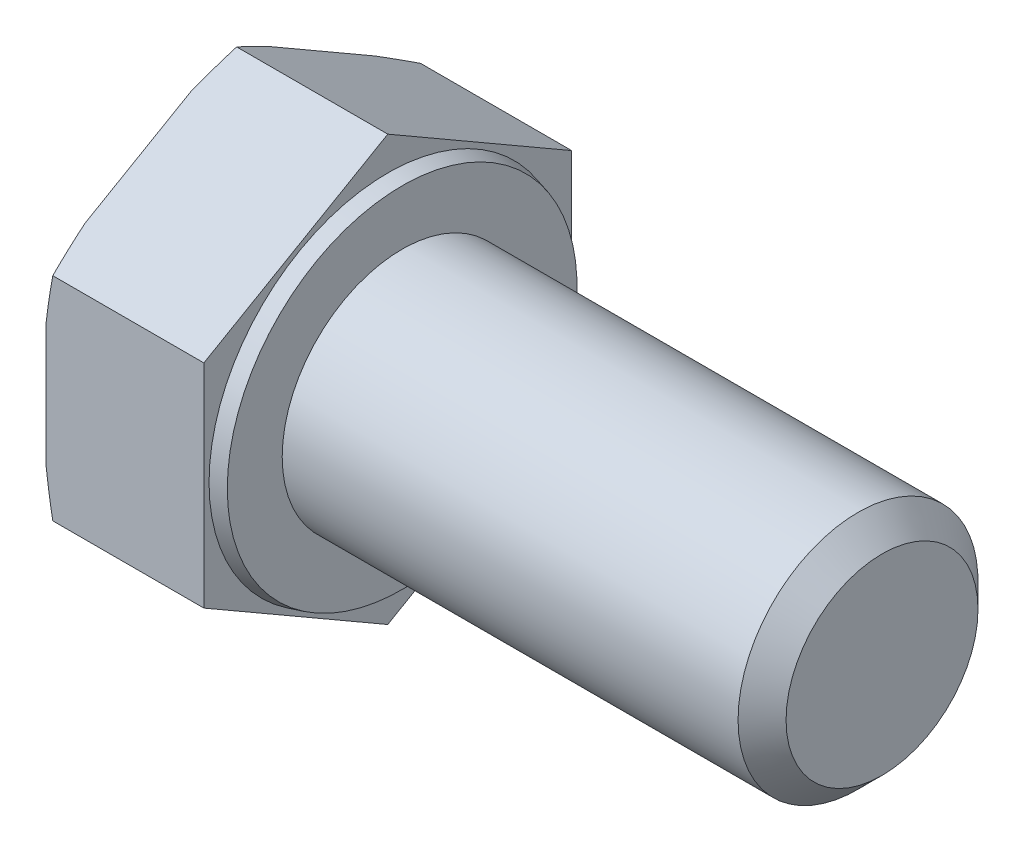
from build123d import *

# Parameters (mm, degrees)
SKETCH_2_OUTSIDE_W  = 27.09
SKETCH_2_OUTSIDE_H  = 27.09
CUT_EXTRUDE_1_DEPTH = 30.923191675
CHAMFER_1_SIZE      = 1


with BuildPart() as part:
    # Эскиз1 → Повернуть1 (revolve)
    with BuildSketch(Plane.XY):
        Polygon((-6.58, 0), (-6.58, 8.85), (0, 8.85), (0, 7.448974596), (0.6, 7.288205081), (0.6, 5), (20.6, 5), (20.6, 0), align=None)
    revolve(axis=Axis((-1000, 0, 0), (1, 0, 0)))

    # Эскиз2 outside → Вырез-Вытянуть1 (cut, through all)
    with BuildSketch(Plane.ZY.offset(6.58)):
        Rectangle(SKETCH_2_OUTSIDE_W, SKETCH_2_OUTSIDE_H)
        Polygon((0, -8.85), (7.664324823, -4.425), (7.664324823, 4.425), (0, 8.85), (-7.664324823, 4.425), (-7.664324823, -4.425), align=None, mode=Mode.SUBTRACT)
    extrude(amount=-CUT_EXTRUDE_1_DEPTH, mode=Mode.SUBTRACT)

    # Эскиз4 → Вырез-Повернуть1 (revolve, cut)
    with BuildSketch(Plane.XY):
        Polygon((-6.58, 8.075), (-6.297923068, 8.85), (-6.58, 8.85), align=None)
    revolve(axis=Axis((-1000, 0, 0), (1, 0, 0)), mode=Mode.SUBTRACT)

    # Фаска1
    chamfer_1_edges = [part.edges().sort_by_distance(p)[0] for p in [
        (20.6, -5, 0),
    ]]
    chamfer(chamfer_1_edges, length=CHAMFER_1_SIZE)


solid = part.part
